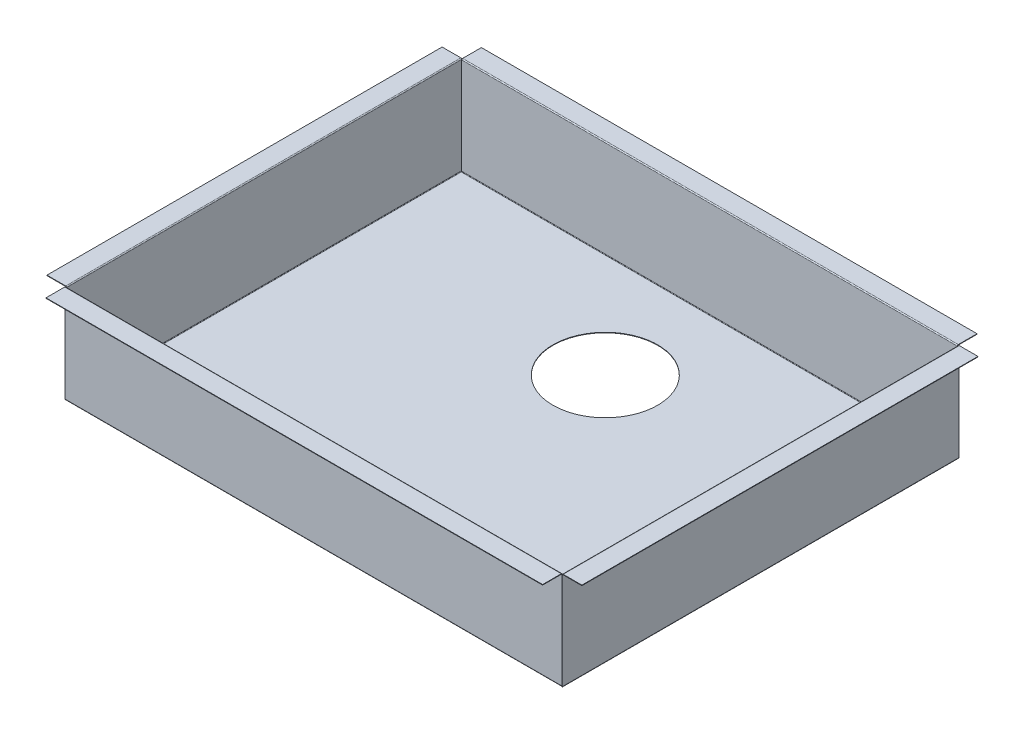
from build123d import *

# Parameters (mm, degrees)
SKETCH1_W                    = 760
SKETCH1_H                    = 605
SKETCH1_R                    = 80
BASE_FLANGE1_DEPTH           = 0.7366
EDGE_FLANGE1_STRIP_W         = 4.4196
EDGE_FLANGE1_STRIP_H         = 0.7366
EDGE_FLANGE1_STRIP_CUT_DEPTH = 605
EDGE_FLANGE1_DEPTH           = 605
EDGE_FLANGE2_STRIP_W         = 4.4196
EDGE_FLANGE2_STRIP_H         = 0.7366
EDGE_FLANGE2_STRIP_CUT_DEPTH = 758.5268
EDGE_FLANGE2_DEPTH           = 758.5268
EDGE_FLANGE3_STRIP_W         = 4.4196
EDGE_FLANGE3_STRIP_H         = 0.7366
EDGE_FLANGE3_STRIP_CUT_DEPTH = 603.5268
EDGE_FLANGE3_DEPTH           = 603.5268
EDGE_FLANGE4_STRIP_W         = 4.4196
EDGE_FLANGE4_STRIP_H         = 0.7366
EDGE_FLANGE4_STRIP_CUT_DEPTH = 757.0536
EDGE_FLANGE4_DEPTH           = 757.0536
EDGE_FLANGE5_STRIP_W         = 4.4196
EDGE_FLANGE5_STRIP_H         = 0.7366
EDGE_FLANGE5_STRIP_CUT_DEPTH = 758.5268
EDGE_FLANGE5_DEPTH           = 758.5268
EDGE_FLANGE6_STRIP_W         = 4.4196
EDGE_FLANGE6_STRIP_H         = 0.7366
EDGE_FLANGE6_STRIP_CUT_DEPTH = 603.5268
EDGE_FLANGE6_DEPTH           = 603.5268
EDGE_FLANGE7_STRIP_W         = 4.4196
EDGE_FLANGE7_STRIP_H         = 0.7366
EDGE_FLANGE7_STRIP_CUT_DEPTH = 757.0536
EDGE_FLANGE7_DEPTH           = 757.0536
EDGE_FLANGE8_STRIP_W         = 4.4196
EDGE_FLANGE8_STRIP_H         = 0.7366
EDGE_FLANGE8_STRIP_CUT_DEPTH = 605
EDGE_FLANGE8_DEPTH           = 605


# Sheet-metal steps are written as plain solids
with BuildPart() as part:
    # Sketch1 → Base-Flange1 (new body)
    with BuildSketch(Plane(origin=(0, 0, 0), x_dir=(1, 0, 0), z_dir=(0, 1, 0))):
        Rectangle(SKETCH1_W, SKETCH1_H)
        with Locations(Location((0, 142.5, 0), (0, 0, 270))):
            Circle(SKETCH1_R, mode=Mode.SUBTRACT)
    extrude(amount=-BASE_FLANGE1_DEPTH)

    # Edge-Flange1 strip (across the edge) → Edge-Flange1 strip cut (cut)
    with BuildSketch(Plane(origin=(380, 0, 302.5), x_dir=(-1, 0, 0), z_dir=(0, 0, -1))):
        with Locations((-0.7366, -0.3683)):
            Rectangle(EDGE_FLANGE1_STRIP_W, EDGE_FLANGE1_STRIP_H)
    extrude(amount=EDGE_FLANGE1_STRIP_CUT_DEPTH, mode=Mode.SUBTRACT)

    # Edge-Flange1 section (across the edge) → Edge-Flange1 (add)
    with BuildSketch(Plane(origin=(380, 0, 302.5), x_dir=(-1, 0, 0), z_dir=(0, 0, -1))):
        with BuildLine():
            Line((0, 0.7366), (0, 149.2634))
            Line((0, 149.2634), (0.7366, 149.2634))
            Line((0.7366, 149.2634), (0.7366, 0.7366))
            ThreePointArc((0.7366, 0.7366), (0.952345145, 0.215745145), (1.4732, 0))
            Line((1.4732, 0), (1.4732, -0.7366))
            ThreePointArc((1.4732, -0.7366), (0.43149029, -0.30510971), (0, 0.7366))
        make_face()
    extrude(amount=EDGE_FLANGE1_DEPTH)

    # Edge-Flange2 strip (across the edge) → Edge-Flange2 strip cut (cut)
    with BuildSketch(Plane(origin=(-380, 0, 302.5), x_dir=(0, 0, -1), z_dir=(1, 0, 0))):
        with Locations((-0.7366, -0.3683)):
            Rectangle(EDGE_FLANGE2_STRIP_W, EDGE_FLANGE2_STRIP_H)
    extrude(amount=EDGE_FLANGE2_STRIP_CUT_DEPTH, mode=Mode.SUBTRACT)

    # Edge-Flange2 section (across the edge) → Edge-Flange2 (add)
    with BuildSketch(Plane(origin=(-380, 0, 302.5), x_dir=(0, 0, -1), z_dir=(1, 0, 0))):
        with BuildLine():
            Line((0, 0.7366), (0, 149.2634))
            Line((0, 149.2634), (0.7366, 149.2634))
            Line((0.7366, 149.2634), (0.7366, 0.7366))
            ThreePointArc((0.7366, 0.7366), (0.952345145, 0.215745145), (1.4732, 0))
            Line((1.4732, 0), (1.4732, -0.7366))
            ThreePointArc((1.4732, -0.7366), (0.43149029, -0.30510971), (0, 0.7366))
        make_face()
    extrude(amount=EDGE_FLANGE2_DEPTH)

    # Edge-Flange3 strip (across the edge) → Edge-Flange3 strip cut (cut)
    with BuildSketch(Plane(origin=(-380, 0, -302.5), x_dir=(1, 0, 0), z_dir=(0, 0, 1))):
        with Locations((-0.7366, -0.3683)):
            Rectangle(EDGE_FLANGE3_STRIP_W, EDGE_FLANGE3_STRIP_H)
    extrude(amount=EDGE_FLANGE3_STRIP_CUT_DEPTH, mode=Mode.SUBTRACT)

    # Edge-Flange3 section (across the edge) → Edge-Flange3 (add)
    with BuildSketch(Plane(origin=(-380, 0, -302.5), x_dir=(1, 0, 0), z_dir=(0, 0, 1))):
        with BuildLine():
            Line((0, 0.7366), (0, 149.2634))
            Line((0, 149.2634), (0.7366, 149.2634))
            Line((0.7366, 149.2634), (0.7366, 0.7366))
            ThreePointArc((0.7366, 0.7366), (0.952345145, 0.215745145), (1.4732, 0))
            Line((1.4732, 0), (1.4732, -0.7366))
            ThreePointArc((1.4732, -0.7366), (0.43149029, -0.30510971), (0, 0.7366))
        make_face()
    extrude(amount=EDGE_FLANGE3_DEPTH)

    # Edge-Flange4 strip (across the edge) → Edge-Flange4 strip cut (cut)
    with BuildSketch(Plane(origin=(378.5268, 0, -302.5), x_dir=(0, 0, 1), z_dir=(-1, 0, 0))):
        with Locations((-0.7366, -0.3683)):
            Rectangle(EDGE_FLANGE4_STRIP_W, EDGE_FLANGE4_STRIP_H)
    extrude(amount=EDGE_FLANGE4_STRIP_CUT_DEPTH, mode=Mode.SUBTRACT)

    # Edge-Flange4 section (across the edge) → Edge-Flange4 (add)
    with BuildSketch(Plane(origin=(378.5268, 0, -302.5), x_dir=(0, 0, 1), z_dir=(-1, 0, 0))):
        with BuildLine():
            Line((0, 0.7366), (0, 149.2634))
            Line((0, 149.2634), (0.7366, 149.2634))
            Line((0.7366, 149.2634), (0.7366, 0.7366))
            ThreePointArc((0.7366, 0.7366), (0.952345145, 0.215745145), (1.4732, 0))
            Line((1.4732, 0), (1.4732, -0.7366))
            ThreePointArc((1.4732, -0.7366), (0.43149029, -0.30510971), (0, 0.7366))
        make_face()
    extrude(amount=EDGE_FLANGE4_DEPTH)

    # Edge-Flange5 strip (across the edge) → Edge-Flange5 strip cut (cut)
    with BuildSketch(Plane(origin=(378.5268, 149.2634, 302.5), x_dir=(0, -1, 0), z_dir=(-1, 0, 0))):
        with Locations((-0.7366, -0.3683)):
            Rectangle(EDGE_FLANGE5_STRIP_W, EDGE_FLANGE5_STRIP_H)
    extrude(amount=EDGE_FLANGE5_STRIP_CUT_DEPTH, mode=Mode.SUBTRACT)

    # Edge-Flange5 section (across the edge) → Edge-Flange5 (add)
    with BuildSketch(Plane(origin=(378.5268, 149.2634, 302.5), x_dir=(0, -1, 0), z_dir=(-1, 0, 0))):
        with BuildLine():
            Line((0, 0.7366), (0, 29.2634))
            Line((0, 29.2634), (0.7366, 29.2634))
            Line((0.7366, 29.2634), (0.7366, 0.7366))
            ThreePointArc((0.7366, 0.7366), (0.952345145, 0.215745145), (1.4732, 0))
            Line((1.4732, 0), (1.4732, -0.7366))
            ThreePointArc((1.4732, -0.7366), (0.43149029, -0.30510971), (0, 0.7366))
        make_face()
    extrude(amount=EDGE_FLANGE5_DEPTH)

    # Edge-Flange6 strip (across the edge) → Edge-Flange6 strip cut (cut)
    with BuildSketch(Plane(origin=(-380, 149.2634, 301.0268), x_dir=(0, -1, 0), z_dir=(0, 0, -1))):
        with Locations((-0.7366, -0.3683)):
            Rectangle(EDGE_FLANGE6_STRIP_W, EDGE_FLANGE6_STRIP_H)
    extrude(amount=EDGE_FLANGE6_STRIP_CUT_DEPTH, mode=Mode.SUBTRACT)

    # Edge-Flange6 section (across the edge) → Edge-Flange6 (add)
    with BuildSketch(Plane(origin=(-380, 149.2634, 301.0268), x_dir=(0, -1, 0), z_dir=(0, 0, -1))):
        with BuildLine():
            Line((0, 0.7366), (0, 29.2634))
            Line((0, 29.2634), (0.7366, 29.2634))
            Line((0.7366, 29.2634), (0.7366, 0.7366))
            ThreePointArc((0.7366, 0.7366), (0.952345145, 0.215745145), (1.4732, 0))
            Line((1.4732, 0), (1.4732, -0.7366))
            ThreePointArc((1.4732, -0.7366), (0.43149029, -0.30510971), (0, 0.7366))
        make_face()
    extrude(amount=EDGE_FLANGE6_DEPTH)

    # Edge-Flange7 strip (across the edge) → Edge-Flange7 strip cut (cut)
    with BuildSketch(Plane(origin=(-378.5268, 149.2634, -302.5), x_dir=(0, -1, 0), z_dir=(1, 0, 0))):
        with Locations((-0.7366, -0.3683)):
            Rectangle(EDGE_FLANGE7_STRIP_W, EDGE_FLANGE7_STRIP_H)
    extrude(amount=EDGE_FLANGE7_STRIP_CUT_DEPTH, mode=Mode.SUBTRACT)

    # Edge-Flange7 section (across the edge) → Edge-Flange7 (add)
    with BuildSketch(Plane(origin=(-378.5268, 149.2634, -302.5), x_dir=(0, -1, 0), z_dir=(1, 0, 0))):
        with BuildLine():
            Line((0, 0.7366), (0, 29.2634))
            Line((0, 29.2634), (0.7366, 29.2634))
            Line((0.7366, 29.2634), (0.7366, 0.7366))
            ThreePointArc((0.7366, 0.7366), (0.952345145, 0.215745145), (1.4732, 0))
            Line((1.4732, 0), (1.4732, -0.7366))
            ThreePointArc((1.4732, -0.7366), (0.43149029, -0.30510971), (0, 0.7366))
        make_face()
    extrude(amount=EDGE_FLANGE7_DEPTH)

    # Edge-Flange8 strip (across the edge) → Edge-Flange8 strip cut (cut)
    with BuildSketch(Plane(origin=(380, 149.2634, -302.5), x_dir=(0, -1, 0), z_dir=(0, 0, 1))):
        with Locations((-0.7366, -0.3683)):
            Rectangle(EDGE_FLANGE8_STRIP_W, EDGE_FLANGE8_STRIP_H)
    extrude(amount=EDGE_FLANGE8_STRIP_CUT_DEPTH, mode=Mode.SUBTRACT)

    # Edge-Flange8 section (across the edge) → Edge-Flange8 (add)
    with BuildSketch(Plane(origin=(380, 149.2634, -302.5), x_dir=(0, -1, 0), z_dir=(0, 0, 1))):
        with BuildLine():
            Line((0, 0.7366), (0, 29.2634))
            Line((0, 29.2634), (0.7366, 29.2634))
            Line((0.7366, 29.2634), (0.7366, 0.7366))
            ThreePointArc((0.7366, 0.7366), (0.952345145, 0.215745145), (1.4732, 0))
            Line((1.4732, 0), (1.4732, -0.7366))
            ThreePointArc((1.4732, -0.7366), (0.43149029, -0.30510971), (0, 0.7366))
        make_face()
    extrude(amount=EDGE_FLANGE8_DEPTH)


solid = part.part
